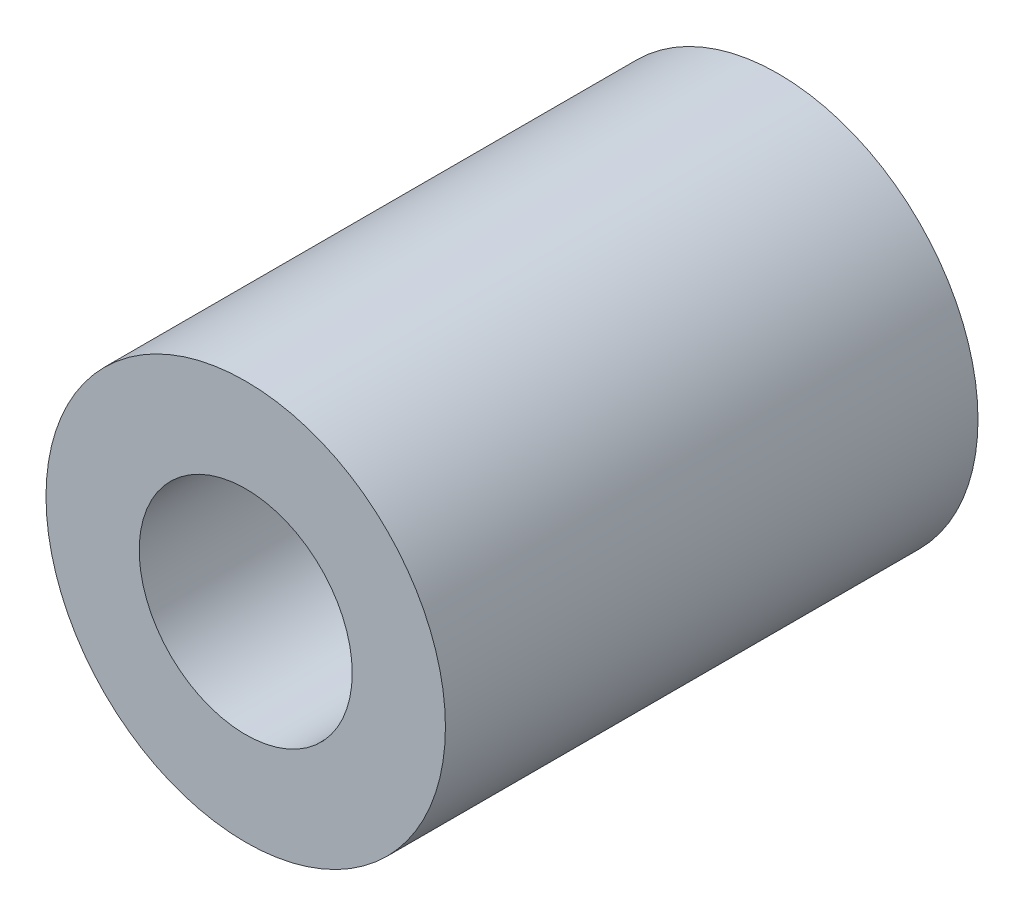
from build123d import *

# Parameters (mm, degrees)
SKETCH1_R           = 7.5
SKETCH1_R_2         = 4
BOSS_EXTRUDE2_DEPTH = 20


with BuildPart() as part:
    # Sketch1 → Boss-Extrude2 (new body)
    with BuildSketch(Plane.XY):
        Circle(SKETCH1_R)
        Circle(SKETCH1_R_2, mode=Mode.SUBTRACT)
    extrude(amount=BOSS_EXTRUDE2_DEPTH)


solid = part.part
